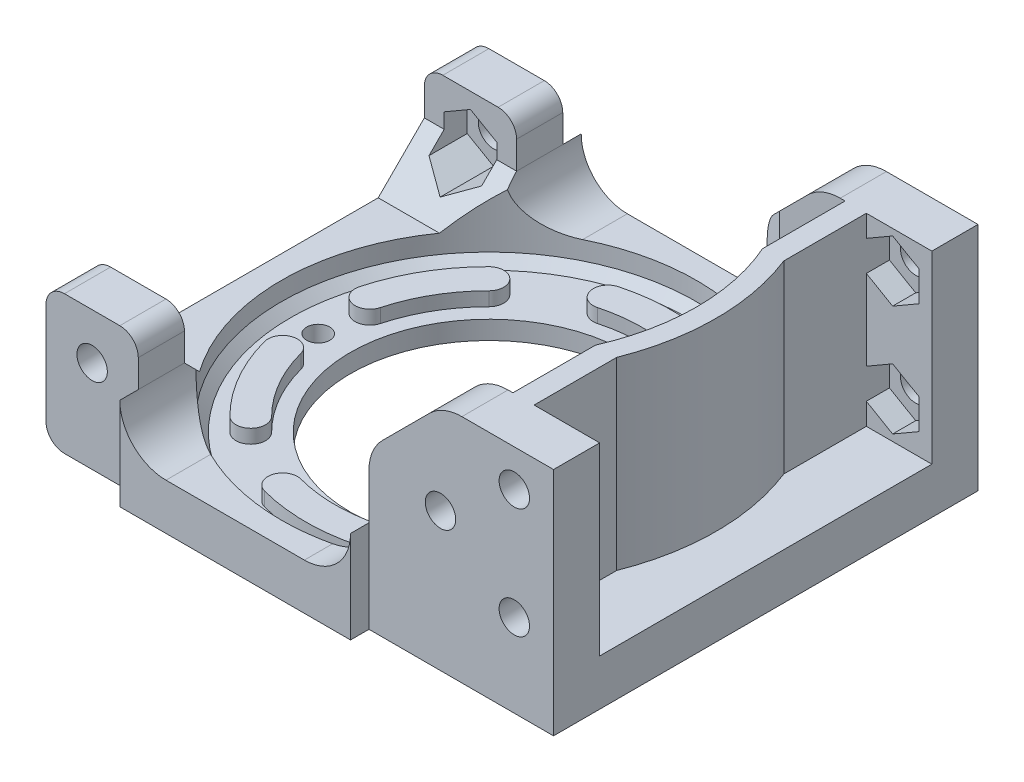
from build123d import *
from build123d.topology import SkipClean

# Parameters (mm, degrees)
SKETCH_1_R                      = 25
EXTRUDE_1_DEPTH                 = 5
SKETCH_23_W                     = 25
SKETCH_23_H                     = 50
EXTRUDE_11_DEPTH                = 5
CUT_EXTRUDE_1_REACH             = 37.707
SKETCH_2_R                      = 15
SKETCH_3_R                      = 22.5
CUT_EXTRUDE_2_DEPTH             = 3
CUT_EXTRUDE_3_REACH             = 37.482
SKETCH_4_R                      = 1.25
CHAMFER_1_SIZE                  = 1
EXTRUDE_2_DEPTH                 = 1.5
EXTRUDE_3_DEPTH                 = 5
EXTRUDE_START                   = 20
EXTRUDE_4_DEPTH                 = 20
CUT_EXTRUDE_5_REACH             = 60.086
SKETCH_11_R                     = 1.65
CUT_EXTRUDE_5_DIRECTION_2_DEPTH = 59.086142926
CUT_EXTRUDE_6_DEPTH             = 2.5
SKETCH_26_W                     = 10
SKETCH_26_H                     = 7
EXTRUDE_12_DEPTH                = 10
FILLET_2_R                      = 5
SKETCH_21_W                     = 20
SKETCH_21_H                     = 25
SKETCH_21_W_2                   = 10
SKETCH_21_H_2                   = 15
CUT_EXTRUDE_11_DEPTH            = 2
CUT_EXTRUDE_12_REACH            = 63.879
SKETCH_28_R                     = 1.65
CUT_EXTRUDE_13_DEPTH            = 2.5
CHAMFER_3_SIZE                  = 5
SKETCH_15_W                     = 2.3
SKETCH_15_H                     = 20
EXTRUDE_9_DEPTH                 = 36
CUT_EXTRUDE_8_REACH             = 48.368
SKETCH_14_R                     = 22.5
EXTRUDE_7_DEPTH                 = 20
CHAMFER_4_SIZE                  = 8
FILLET_3_R                      = 5
FILLET_6_R                      = 2


# Read off the part's stored shape, not the designer's step: 镜向3
with BuildPart() as part:
    # 草图1 → 凸台-拉伸1 (new body)
    with BuildSketch(Plane(origin=(0, 0, 0), x_dir=(1, 0, 0), z_dir=(0, 1, 0))):
        with Locations(Location((0, 0, 0), (0, 0, 270))):
            Circle(SKETCH_1_R)
    extrude(amount=EXTRUDE_1_DEPTH)

    # 草图23 → 凸台-拉伸11 (add)
    with BuildSketch(Plane(origin=(0, 0, 0), x_dir=(1, 0, 0), z_dir=(0, 1, 0))):
        with Locations((-12.5, 0)):
            Rectangle(SKETCH_23_W, SKETCH_23_H)
    extrude(amount=EXTRUDE_11_DEPTH)

    # 草图2 → 切除-拉伸1 (cut, up to next)
    with BuildSketch(Plane(origin=(0, 5, 0), x_dir=(1, 0, 0), z_dir=(0, 1, 0)), mode=Mode.PRIVATE) as cut_extrude_1_sk1:
        with Locations(Location((0, 0, 0), (0, 0, 270))):
            Circle(SKETCH_2_R)
    cut_extrude_1_tool1 = extrude(cut_extrude_1_sk1.sketch, amount=-CUT_EXTRUDE_1_REACH, mode=Mode.PRIVATE) & part.part
    add(cut_extrude_1_tool1.solids().sort_by_distance((0, 5, 0))[0], mode=Mode.SUBTRACT)

    # 草图3 → 切除-拉伸2 (cut)
    with BuildSketch(Plane(origin=(0, 5, 0), x_dir=(1, 0, 0), z_dir=(0, 1, 0))):
        with Locations(Location((0, 0, 0), (0, 0, 270))):
            Circle(SKETCH_3_R)
    extrude(amount=-CUT_EXTRUDE_2_DEPTH, mode=Mode.SUBTRACT)

    # 草图4 → 切除-拉伸3 (cut, up to next)
    with BuildSketch(Plane(origin=(0, 2, 0), x_dir=(1, 0, 0), z_dir=(0, 1, 0)), mode=Mode.PRIVATE) as cut_extrude_3_sk1:
        with Locations(Location((9.25, -16.02146997, 0), (0, 0, 270))):
            Circle(SKETCH_4_R)
    cut_extrude_3_tool1 = extrude(cut_extrude_3_sk1.sketch, amount=-CUT_EXTRUDE_3_REACH, mode=Mode.PRIVATE) & part.part
    # 草图4 → 切除-拉伸3 (cut, up to next)
    with BuildSketch(Plane(origin=(0, 2, 0), x_dir=(1, 0, 0), z_dir=(0, 1, 0)), mode=Mode.PRIVATE) as cut_extrude_3_sk2:
        with Locations(Location((-18.5, 0, 0), (0, 0, 270))):
            Circle(SKETCH_4_R)
    cut_extrude_3_tool2 = extrude(cut_extrude_3_sk2.sketch, amount=-CUT_EXTRUDE_3_REACH, mode=Mode.PRIVATE) & part.part
    # 草图4 → 切除-拉伸3 (cut, up to next)
    with BuildSketch(Plane(origin=(0, 2, 0), x_dir=(1, 0, 0), z_dir=(0, 1, 0)), mode=Mode.PRIVATE) as cut_extrude_3_sk3:
        with Locations(Location((9.25, 16.02146997, 0), (0, 0, 270))):
            Circle(SKETCH_4_R)
    cut_extrude_3_tool3 = extrude(cut_extrude_3_sk3.sketch, amount=-CUT_EXTRUDE_3_REACH, mode=Mode.PRIVATE) & part.part
    add(cut_extrude_3_tool1.solids().sort_by_distance((9.25, 2, 16.02147))[0], mode=Mode.SUBTRACT)
    add(cut_extrude_3_tool2.solids().sort_by_distance((-18.5, 2, 0))[0], mode=Mode.SUBTRACT)
    add(cut_extrude_3_tool3.solids().sort_by_distance((9.25, 2, -16.02147))[0], mode=Mode.SUBTRACT)

    # 倒角1
    chamfer_1_edges = [part.edges().sort_by_distance(p)[0] for p in [
        (0, 2, -22.5),
    ]]
    chamfer(chamfer_1_edges, length=CHAMFER_1_SIZE)

    # 草图7 → 凸台-拉伸2 (add)
    with BuildSketch(Plane(origin=(0, 2, 0), x_dir=(1, 0, 0), z_dir=(0, 1, 0))):
        with BuildLine():
            ThreePointArc((5.137558045, 19.173627652), (0, 19.85), (-5.137558045, 19.173627652))
            ThreePointArc((-5.137558045, 19.173627652), (-6.268928895, 17.214035858), (-4.309337101, 16.082665008))
            ThreePointArc((-4.309337101, 16.082665008), (0, 16.65), (4.309337101, 16.082665008))
            ThreePointArc((4.309337101, 16.082665008), (6.268928895, 17.214035858), (5.137558045, 19.173627652))
        make_face()
        with BuildLine():
            ThreePointArc((19.173627652, 5.137558045), (17.190604265, 9.925), (14.036069607, 14.036069607))
            ThreePointArc((14.036069607, 14.036069607), (11.773327907, 14.036069607), (11.773327907, 11.773327907))
            ThreePointArc((11.773327907, 11.773327907), (14.419322973, 8.325), (16.082665008, 4.309337101))
            ThreePointArc((16.082665008, 4.309337101), (18.042256802, 3.177966251), (19.173627652, 5.137558045))
        make_face()
        with BuildLine():
            ThreePointArc((14.036069607, -14.036069607), (17.190604265, -9.925), (19.173627652, -5.137558045))
            ThreePointArc((19.173627652, -5.137558045), (18.042256802, -3.177966251), (16.082665008, -4.309337101))
            ThreePointArc((16.082665008, -4.309337101), (14.419322973, -8.325), (11.773327907, -11.773327907))
            ThreePointArc((11.773327907, -11.773327907), (11.773327907, -14.036069607), (14.036069607, -14.036069607))
        make_face()
        with BuildLine():
            ThreePointArc((-5.137558045, -19.173627652), (0, -19.85), (5.137558045, -19.173627652))
            ThreePointArc((5.137558045, -19.173627652), (6.268928895, -17.214035858), (4.309337101, -16.082665008))
            ThreePointArc((4.309337101, -16.082665008), (0, -16.65), (-4.309337101, -16.082665008))
            ThreePointArc((-4.309337101, -16.082665008), (-6.268928895, -17.214035858), (-5.137558045, -19.173627652))
        make_face()
        with BuildLine():
            ThreePointArc((-19.173627652, -5.137558045), (-17.190604265, -9.925), (-14.036069607, -14.036069607))
            ThreePointArc((-14.036069607, -14.036069607), (-11.773327907, -14.036069607), (-11.773327907, -11.773327907))
            ThreePointArc((-11.773327907, -11.773327907), (-14.419322973, -8.325), (-16.082665008, -4.309337101))
            ThreePointArc((-16.082665008, -4.309337101), (-18.042256802, -3.177966251), (-19.173627652, -5.137558045))
        make_face()
        with BuildLine():
            ThreePointArc((-14.036069607, 14.036069607), (-17.190604265, 9.925), (-19.173627652, 5.137558045))
            ThreePointArc((-19.173627652, 5.137558045), (-18.042256802, 3.177966251), (-16.082665008, 4.309337101))
            ThreePointArc((-16.082665008, 4.309337101), (-14.419322973, 8.325), (-11.773327907, 11.773327907))
            ThreePointArc((-11.773327907, 11.773327907), (-11.773327907, 14.036069607), (-14.036069607, 14.036069607))
        make_face()
    extrude(amount=EXTRUDE_2_DEPTH)

    # 草图8 → 凸台-拉伸3 (add)
    with BuildSketch(Plane(origin=(0, 0, 0), x_dir=(1, 0, 0), z_dir=(0, 1, 0))):
        with BuildLine():
            Line((0, 25), (30, 25))
            Line((30, 25), (30, -25))
            Line((30, -25), (0, -25))
            ThreePointArc((0, -25), (25, 0), (0, 25))
        make_face()
    extrude(amount=EXTRUDE_3_DEPTH)

    # 草图9 → 凸台-拉伸4 (add)
    with SkipClean():  # the faces are left unmerged after this step: merging them gives an invalid solid
        with BuildSketch(Plane(origin=(0, 5, 0), x_dir=(1, 0, 0), z_dir=(0, 1, 0)).offset(EXTRUDE_START)):
            with BuildLine():
                Line((13.5, 18), (30, 18))
                Line((30, 18), (30, 25))
                Line((30, 25), (10, 25))
                Line((10, 25), (10, 20.155644371))
                ThreePointArc((10, 20.155644371), (11.799330518, 19.157917406), (13.5, 18))
            make_face()
        extrude(amount=-EXTRUDE_4_DEPTH)

    # 草图11 → 切除-拉伸5 (cut, up to next)
    with BuildSketch(Plane.XY.offset(-18), mode=Mode.PRIVATE) as cut_extrude_5_sk1:
        with Locations(Location((17.75, 15, 0), (0, 0, 180))):
            Circle(SKETCH_11_R)
    cut_extrude_5_tool1 = extrude(cut_extrude_5_sk1.sketch, amount=-CUT_EXTRUDE_5_REACH, mode=Mode.PRIVATE) & part.part
    # 草图11 → 切除-拉伸5 (cut, up to next)
    with BuildSketch(Plane.XY.offset(-18), mode=Mode.PRIVATE) as cut_extrude_5_sk2:
        with Locations(Location((25.75, 21, 0), (0, 0, 180))):
            Circle(SKETCH_11_R)
    cut_extrude_5_tool2 = extrude(cut_extrude_5_sk2.sketch, amount=-CUT_EXTRUDE_5_REACH, mode=Mode.PRIVATE) & part.part
    # 草图11 → 切除-拉伸5 (cut, up to next)
    with BuildSketch(Plane.XY.offset(-18), mode=Mode.PRIVATE) as cut_extrude_5_sk3:
        with Locations(Location((25.75, 9, 0), (0, 0, 180))):
            Circle(SKETCH_11_R)
    cut_extrude_5_tool3 = extrude(cut_extrude_5_sk3.sketch, amount=-CUT_EXTRUDE_5_REACH, mode=Mode.PRIVATE) & part.part
    add(cut_extrude_5_tool1.solids().sort_by_distance((17.75, 15, -18))[0], mode=Mode.SUBTRACT)
    add(cut_extrude_5_tool2.solids().sort_by_distance((25.75, 21, -18))[0], mode=Mode.SUBTRACT)
    add(cut_extrude_5_tool3.solids().sort_by_distance((25.75, 9, -18))[0], mode=Mode.SUBTRACT)

    # 草图11 → 切除-拉伸5 direction 2 (cut)
    with SkipClean():  # the faces are left unmerged after this step: merging them gives an invalid solid
        with BuildSketch(Plane.XY.offset(-18)):
            with Locations(Location((17.75, 15, 0), (0, 0, 180))):
                Circle(SKETCH_11_R)
            with Locations(Location((25.75, 21, 0), (0, 0, 180))):
                Circle(SKETCH_11_R)
            with Locations(Location((25.75, 9, 0), (0, 0, 180))):
                Circle(SKETCH_11_R)
        extrude(amount=CUT_EXTRUDE_5_DIRECTION_2_DEPTH, mode=Mode.SUBTRACT)

    # 草图12 → 切除-拉伸6 (cut)
    with SkipClean():  # the faces are left unmerged after this step: merging them gives an invalid solid
        with BuildSketch(Plane.XY.offset(-18)):
            Polygon((28.6, 22.645448267), (25.75, 24.290896534), (22.9, 22.645448267), (22.9, 19.354551733), (25.75, 17.709103466), (28.6, 19.354551733), align=None)
            Polygon((28.6, 10.645448267), (25.75, 12.290896534), (22.9, 10.645448267), (22.9, 7.354551733), (25.75, 5.709103466), (28.6, 7.354551733), align=None)
            Polygon((20.6, 16.645448267), (17.75, 18.290896534), (14.9, 16.645448267), (14.9, 13.354551733), (17.75, 11.709103466), (20.6, 13.354551733), align=None)
        extrude(amount=-CUT_EXTRUDE_6_DEPTH, mode=Mode.SUBTRACT)

    # 草图26 → 凸台-拉伸12 (add)
    with SkipClean():  # the faces are left unmerged after this step: merging them gives an invalid solid
        with BuildSketch(Plane(origin=(0, 5, 0), x_dir=(1, 0, 0), z_dir=(0, 1, 0))):
            with Locations((-20, 21.5)):
                Rectangle(SKETCH_26_W, SKETCH_26_H)
        extrude(amount=EXTRUDE_12_DEPTH)

    # 圆角2
    # the kernel refuses this fillet: 5 mm, written as the material it adds along each edge
    with BuildSketch(Plane(origin=(10, 5, -25), x_dir=(-1, 0, 0), z_dir=(0, 0, 1))) as fillet_2_piece_1_section:
        with BuildLine():
            CenterArc((FILLET_2_R, -FILLET_2_R), FILLET_2_R, 90, 90)
            Line((0, -FILLET_2_R), (0, 0))
            Line((0, 0), (FILLET_2_R, 0))
        make_face()
    fillet_2_piece_1 = extrude(amount=17.344355629, mode=Mode.PRIVATE)
    fillet_2_piece_1 = fillet_2_piece_1 - Plane(origin=(0, 6.196795152, 0), x_dir=(0, 0, 1), z_dir=(0, 1, 0)) * Cylinder(22.5, 55, mode=Mode.PRIVATE)
    add(fillet_2_piece_1)
    with BuildSketch(Plane(origin=(-15, 5, -25), x_dir=(1, 0, 0), z_dir=(0, 0, 1))) as fillet_2_piece_2_section:
        with BuildLine():
            CenterArc((FILLET_2_R, FILLET_2_R), FILLET_2_R, 180, 90)
            Line((0, FILLET_2_R), (0, 0))
            Line((0, 0), (FILLET_2_R, 0))
        make_face()
    fillet_2_piece_2 = extrude(amount=7, mode=Mode.PRIVATE)
    fillet_2_piece_2 = fillet_2_piece_2 - Plane(origin=(0, 6.161107278, 0), x_dir=(0, 0, 1), z_dir=(0, 1, 0)) * Cylinder(22.5, 34, mode=Mode.PRIVATE)
    add(fillet_2_piece_2)

    # 草图21 → 切除-拉伸11 (cut)
    with BuildSketch(Plane(origin=(0, 0, -25), x_dir=(-1, 0, 0), z_dir=(0, 0, -1))):
        with Locations((-20, 12.5)):
            Rectangle(SKETCH_21_W, SKETCH_21_H)
        with Locations((20, 7.5)):
            Rectangle(SKETCH_21_W_2, SKETCH_21_H_2)
    extrude(amount=-CUT_EXTRUDE_11_DEPTH, mode=Mode.SUBTRACT)

    # 草图28 → 切除-拉伸12 (cut, up to next)
    with BuildSketch(Plane(origin=(0, 0, -23), x_dir=(-1, 0, 0), z_dir=(0, 0, -1)), mode=Mode.PRIVATE) as cut_extrude_12_sk1:
        with Locations((20, 10)):
            Circle(SKETCH_28_R)
    cut_extrude_12_tool1 = extrude(cut_extrude_12_sk1.sketch, amount=-CUT_EXTRUDE_12_REACH, mode=Mode.PRIVATE) & part.part
    add(cut_extrude_12_tool1.solids().sort_by_distance((-20, 10, -23))[0], mode=Mode.SUBTRACT)

    # 草图29 → 切除-拉伸13 (cut)
    with BuildSketch(Plane.XY.offset(-18)):
        Polygon((-20, 6.709103466), (-17.15, 8.354551733), (-17.15, 11.645448267), (-20, 13.290896534), (-22.85, 11.645448267), (-22.85, 8.354551733), align=None)
    extrude(amount=-CUT_EXTRUDE_13_DEPTH, mode=Mode.SUBTRACT)

    # 倒角3
    # the kernel refuses this chamfer: 5 mm, written as the material it adds along each edge
    with BuildSketch(Plane(origin=(-15, 5, -18), x_dir=(0, 0.9996219169112968, -0.027495876610586317), z_dir=(-1, 0, 0))) as chamfer_3_piece_1_section:
        Polygon((CHAMFER_3_SIZE * 0.999621916911, -CHAMFER_3_SIZE * 0.0274958766106), (-CHAMFER_3_SIZE * 0.0274958766106, -CHAMFER_3_SIZE * 0.999621916911), (0, 0), align=None)
    chamfer_3_piece_1 = extrude(amount=22.85841494, mode=Mode.PRIVATE)
    chamfer_3_piece_1 = chamfer_3_piece_1 - Plane(origin=(0, 9.167941379, 0), x_dir=(0, 0, 1), z_dir=(0, 1, 0)) * Cylinder(22.5, 66, mode=Mode.PRIVATE)
    chamfer_3_piece_1 = split(chamfer_3_piece_1, bisect_by=Plane(origin=(-17.15, 9.167941379, -17.58397069), z_dir=(1, 0, 0)), keep=Keep.TOP, mode=Mode.PRIVATE)
    add(chamfer_3_piece_1)
    with BuildSketch(Plane(origin=(-15, 5, -18), x_dir=(0, 0.9996219169112968, -0.027495876610586317), z_dir=(-1, 0, 0))) as chamfer_3_piece_2_section:
        Polygon((CHAMFER_3_SIZE * 0.999621916911, -CHAMFER_3_SIZE * 0.0274958766106), (-CHAMFER_3_SIZE * 0.0274958766106, -CHAMFER_3_SIZE * 0.999621916911), (0, 0), align=None)
    chamfer_3_piece_2 = extrude(amount=22.85841494, mode=Mode.PRIVATE)
    chamfer_3_piece_2 = chamfer_3_piece_2 - Plane(origin=(0, 6.593043937, 0), x_dir=(0, 0, 1), z_dir=(0, 1, 0)) * Cylinder(22.5, 66, mode=Mode.PRIVATE)
    chamfer_3_piece_2 = split(chamfer_3_piece_2, bisect_by=Plane(origin=(-18.636843472, 7.496122254, -16.334895417), z_dir=(0.5000000000000009, -0.8660254037844382, 0)), keep=Keep.TOP, mode=Mode.PRIVATE)
    add(chamfer_3_piece_2)
    with BuildSketch(Plane(origin=(-15, 5, -18), x_dir=(0, 0.9996219169112968, -0.027495876610586317), z_dir=(-1, 0, 0))) as chamfer_3_piece_3_section:
        Polygon((CHAMFER_3_SIZE * 0.999621916911, -CHAMFER_3_SIZE * 0.0274958766106), (-CHAMFER_3_SIZE * 0.0274958766106, -CHAMFER_3_SIZE * 0.999621916911), (0, 0), align=None)
    chamfer_3_piece_3 = extrude(amount=10, mode=Mode.PRIVATE)
    chamfer_3_piece_3 = split(chamfer_3_piece_3, bisect_by=Plane(origin=(-21.484375, 5.85209916, -16.285991388), z_dir=(-0.5000000000000009, 0.8660254037844382, 0)), keep=Keep.TOP, mode=Mode.PRIVATE)
    chamfer_3_piece_3 = split(chamfer_3_piece_3, bisect_by=Plane(origin=(-21.365625, 7.497547427, -16.285991388), z_dir=(-0.5000000000000001, -0.8660254037844386, 0)), keep=Keep.TOP, mode=Mode.PRIVATE)
    add(chamfer_3_piece_3)
    with BuildSketch(Plane(origin=(-15, 5, -18), x_dir=(0, 0.9996219169112968, -0.027495876610586317), z_dir=(-1, 0, 0))) as chamfer_3_piece_4_section:
        Polygon((CHAMFER_3_SIZE * 0.999621916911, -CHAMFER_3_SIZE * 0.0274958766106), (-CHAMFER_3_SIZE * 0.0274958766106, -CHAMFER_3_SIZE * 0.999621916911), (0, 0), align=None)
    chamfer_3_piece_4 = extrude(amount=10, mode=Mode.PRIVATE)
    chamfer_3_piece_4 = split(chamfer_3_piece_4, bisect_by=Plane(origin=(-22.85, 9.167941379, -17.58397069), z_dir=(-1, 0, 0)), keep=Keep.TOP, mode=Mode.PRIVATE)
    add(chamfer_3_piece_4)
    with BuildSketch(Plane(origin=(-15, 5, -18), x_dir=(0, 0.9996219169112968, -0.027495876610586317), z_dir=(1, 0, 0))) as chamfer_3_piece_5_section:
        Polygon((CHAMFER_3_SIZE * 0.999621916911, CHAMFER_3_SIZE * 0.0274958766106), (-CHAMFER_3_SIZE * 0.0274958766106, CHAMFER_3_SIZE * 0.999621916911), (0, 0), align=None)
    chamfer_3_piece_5 = extrude(amount=14.35841494, mode=Mode.PRIVATE)
    chamfer_3_piece_5 = chamfer_3_piece_5 - Plane(origin=(-10, 10, -17.561871944), x_dir=(1, 0, 0), z_dir=(0, 0, -1)) * Cylinder(5, 49, mode=Mode.PRIVATE)
    chamfer_3_piece_5 = chamfer_3_piece_5 - Plane(origin=(0, 6.59714937, 0), x_dir=(0, 0, 1), z_dir=(0, 1, 0)) * Cylinder(22.5, 49, mode=Mode.PRIVATE)
    add(chamfer_3_piece_5)

    # 镜向3
    split(bisect_by=Plane.XY, keep=Keep.BOTTOM)

    # Mirror 3 2: part across plane


with BuildPart() as part_1:
    add(part.part)
    add(part.part.mirror(Plane.XY))

    # 草图15 → 凸台-拉伸9 (add)
    with BuildSketch(Plane.XY.offset(-18)):
        with Locations((21.75, 15)):
            Rectangle(SKETCH_15_W, SKETCH_15_H)
    extrude(amount=EXTRUDE_9_DEPTH)

    # 草图14 → 切除-拉伸8 (cut, up to next)
    with BuildSketch(Plane(origin=(0, 25, 0), x_dir=(1, 0, 0), z_dir=(0, 1, 0)), mode=Mode.PRIVATE) as cut_extrude_8_sk1:
        with Locations(Location((0, 0, 0), (0, 0, 270))):
            Circle(SKETCH_14_R)
    cut_extrude_8_tool1 = extrude(cut_extrude_8_sk1.sketch, amount=-CUT_EXTRUDE_8_REACH, mode=Mode.PRIVATE) & part_1.part
    add(cut_extrude_8_tool1.solids().sort_by_distance((0, 25, 0))[0], mode=Mode.SUBTRACT)

    # 草图16 → 凸台-拉伸7 (add)
    with BuildSketch(Plane(origin=(0, 5, 0), x_dir=(1, 0, 0), z_dir=(0, 1, 0))):
        with BuildLine():
            Line((22.9, 9.049309366), (22.9, -9.049309366))
            ThreePointArc((22.9, -9.049309366), (24.62315983, 0), (22.9, 9.049309366))
        make_face()
    extrude(amount=EXTRUDE_7_DEPTH)

    # 倒角4
    chamfer_4_edges = [part_1.edges().sort_by_distance(p)[0] for p in [
        (10, 25, 21.577822185),
        (10, 25, -21.577822185),
    ]]
    chamfer(chamfer_4_edges, length=CHAMFER_4_SIZE)

    # 圆角3
    fillet_3_edges = [part_1.edges().sort_by_distance(p)[0] for p in [
        (10, 17, 21.577822185),
        (18, 25, 20.5),
        (10, 17, -21.577822185),
        (18, 25, -20.5),
    ]]
    fillet(fillet_3_edges, radius=FILLET_3_R)

    # 圆角6
    fillet_6_edges = [part_1.edges().sort_by_distance(p)[0] for p in [
        (-15, 15, -20.5),
        (-25, 15, -20.5),
        (-25, 0, 0),
        (-15, 15, 20.5),
        (-25, 15, 20.5),
    ]]
    fillet(fillet_6_edges, radius=FILLET_6_R)


solid = part_1.part
